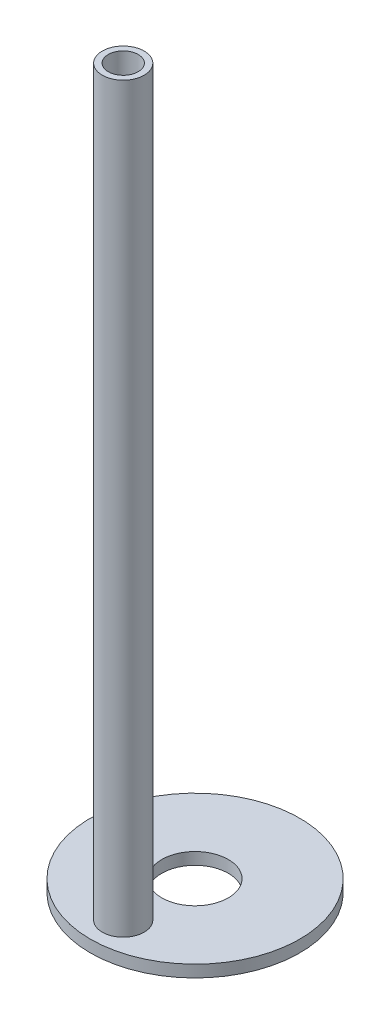
from build123d import *

# Parameters (mm, degrees)
SKETCH2_R          = 17.5
SKETCH2_R_2        = 5.55625
PLATE_DEPTH        = 1
SKETCH2_4_R        = 3.5
ROD_DEPTH          = 125
SKETCH3_R          = 2.5
CUT_EXTRUDE1_DEPTH = 129.407554295


with BuildPart() as part:
    # Sketch2 → Plate (new, symmetric)
    with BuildSketch(Plane(origin=(0, 0, 0), x_dir=(1, 0, 0), z_dir=(0, 1, 0))):
        Circle(SKETCH2_R)
        Circle(SKETCH2_R_2, mode=Mode.SUBTRACT)
    extrude(amount=PLATE_DEPTH, both=True)

    # Sketch2<4> → Rod (add)
    with BuildSketch(Plane(origin=(0, 0, 0), x_dir=(1, 0, 0), z_dir=(0, 1, 0))):
        with Locations((0, -12)):
            Circle(SKETCH2_4_R)
    extrude(amount=ROD_DEPTH)

    # Sketch3 → Cut-Extrude1 (cut, through all)
    with BuildSketch(Plane(origin=(0, 125, 0), x_dir=(1, 0, 0), z_dir=(0, 1, 0))):
        with Locations((0, -12)):
            Circle(SKETCH3_R)
    extrude(amount=-CUT_EXTRUDE1_DEPTH, mode=Mode.SUBTRACT)


solid = part.part
